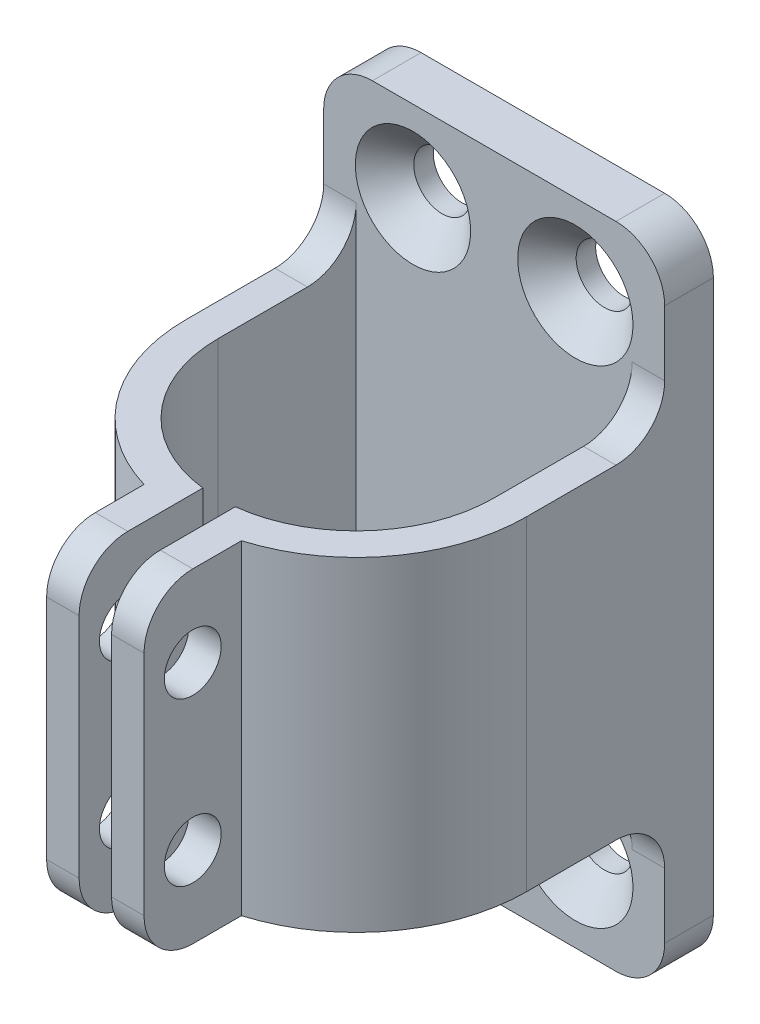
from build123d import *

# Parameters (mm, degrees)
SKETCH1_W               = 21
SKETCH1_H               = 40
SKETCH1_R               = 1.75
BOSS_EXTRUDE1_DEPTH     = 3
BOSS_EXTRUDE2_DEPTH     = 10
CUT_EXTRUDE1_DEPTH      = 37.632372384
CUT_EXTRUDE1_DEPTH_BACK = 37.632372384
SKETCH4_R               = 1.75
CHAMFER1_SIZE           = 1.8
FILLET1_R               = 3
FILLET2_R               = 3


with BuildPart() as part:
    # Sketch1 → Boss-Extrude1 (new body)
    with BuildSketch(Plane.XY):
        Rectangle(SKETCH1_W, SKETCH1_H)
        with Locations((-5, 15)):
            Circle(SKETCH1_R, mode=Mode.SUBTRACT)
        with Locations((5, 15)):
            Circle(SKETCH1_R, mode=Mode.SUBTRACT)
        with Locations((5, -15)):
            Circle(SKETCH1_R, mode=Mode.SUBTRACT)
        with Locations((-5, -15)):
            Circle(SKETCH1_R, mode=Mode.SUBTRACT)
    extrude(amount=BOSS_EXTRUDE1_DEPTH)

    # Sketch3 → Boss-Extrude2 (add, symmetric)
    with BuildSketch(Plane(origin=(0, 0, 0), x_dir=(1, 0, 0), z_dir=(0, 1, 0))):
        with BuildLine():
            Line((-8.5, -3), (-8.5, -11.5))
            ThreePointArc((-8.5, -11.5), (-6.354132514, -17.145794895), (-1, -19.940971508))
            Line((-1, -19.940971508), (-1, -27.562305899))
            Line((-1, -27.562305899), (-3, -27.562305899))
            Line((-3, -27.562305899), (-3, -21.562305899))
            ThreePointArc((-3, -21.562305899), (-8.41872912, -17.774950199), (-10.5, -11.5))
            Line((-10.5, -11.5), (-10.5, -3))
            Line((-10.5, -3), (-8.5, -3))
        make_face()
        with BuildLine():
            Line((10.5, -11.5), (10.5, -3))
            Line((10.5, -3), (8.5, -3))
            Line((8.5, -3), (8.5, -11.5))
            ThreePointArc((8.5, -11.5), (6.354132514, -17.145794895), (1, -19.940971508))
            Line((1, -19.940971508), (1, -27.562305899))
            Line((1, -27.562305899), (3, -27.562305899))
            Line((3, -27.562305899), (3, -21.562305899))
            ThreePointArc((3, -21.562305899), (8.41872912, -17.774950199), (10.5, -11.5))
        make_face()
    extrude(amount=BOSS_EXTRUDE2_DEPTH, both=True)

    # Sketch4 → Cut-Extrude1 (cut, two sides: drawn at the far end of the back side and taken through both)
    with BuildSketch(Plane(origin=(3, 0, 0), x_dir=(0, 0, -1), z_dir=(1, 0, 0)).offset(-CUT_EXTRUDE1_DEPTH_BACK)):
        with Locations((-24.562305899, 5)):
            Circle(SKETCH4_R)
        with Locations((-24.562305899, -5)):
            Circle(SKETCH4_R)
    extrude(amount=CUT_EXTRUDE1_DEPTH + CUT_EXTRUDE1_DEPTH_BACK, mode=Mode.SUBTRACT)

    # Chamfer1
    chamfer1_edges = [part.edges().sort_by_distance(p)[0] for p in [
        (3.25, -15, 3),
        (-6.75, -15, 3),
        (3.25, 15, 3),
        (-6.75, 15, 3),
    ]]
    chamfer(chamfer1_edges, length=CHAMFER1_SIZE)

    # Fillet1
    fillet1_edges = [part.edges().sort_by_distance(p)[0] for p in [
        (-10.5, 20, 1.5),
        (-10.5, -20, 1.5),
        (10.5, -20, 1.5),
        (10.5, 20, 1.5),
        (2, -10, 27.562305899),
        (-2, -10, 27.562305899),
        (-2, 10, 27.562305899),
        (2, 10, 27.562305899),
    ]]
    fillet(fillet1_edges, radius=FILLET1_R)

    # Fillet2
    fillet2_edges = [part.edges().sort_by_distance(p)[0] for p in [
        (9.5, -10, 3),
        (-9.5, -10, 3),
        (9.5, 10, 3),
        (-9.5, 10, 3),
    ]]
    fillet(fillet2_edges, radius=FILLET2_R)


solid = part.part
